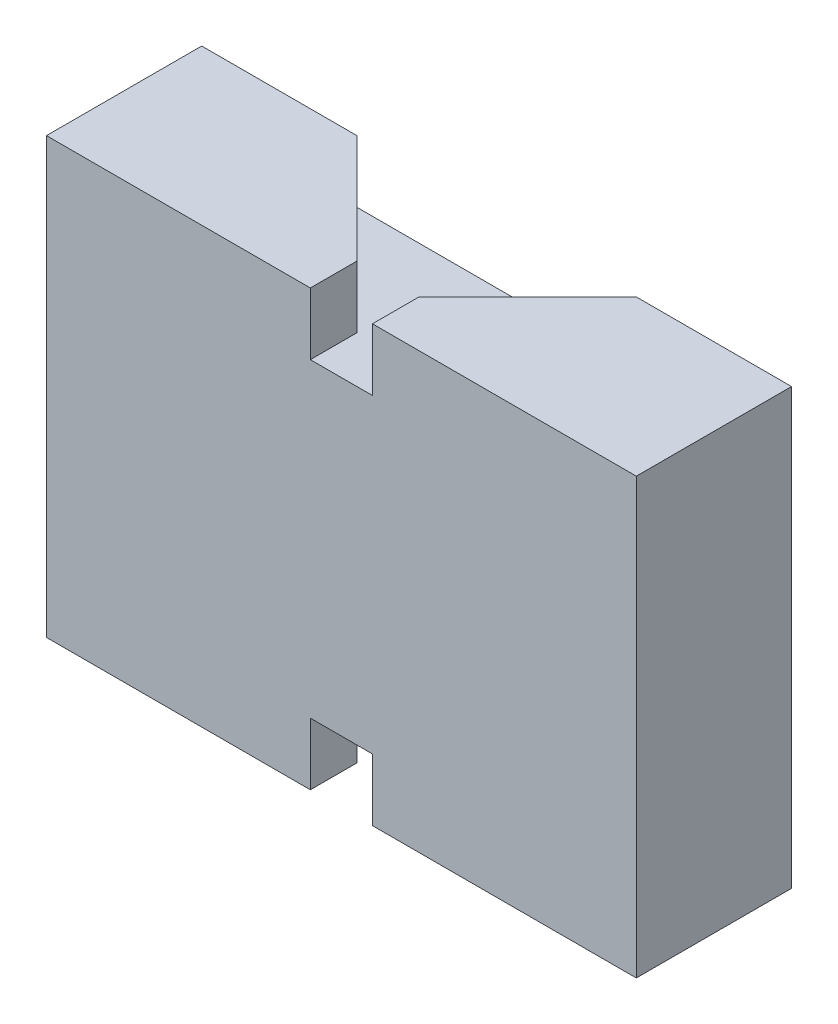
from build123d import *

# Parameters (mm, degrees)
SKETCH1_W           = 190
SKETCH1_H           = 140
BOSS_EXTRUDE1_DEPTH = 50
CUT_EXTRUDE1_DEPTH  = 20


with BuildPart() as part:
    # Sketch1 → Boss-Extrude1 (new body)
    with BuildSketch(Plane.XY):
        Rectangle(SKETCH1_W, SKETCH1_H)
    extrude(amount=BOSS_EXTRUDE1_DEPTH)

    # Sketch2 → Cut-Extrude1 (cut)
    with BuildSketch(Plane(origin=(0, -70, 0), x_dir=(-1, 0, 0), z_dir=(0, -1, 0))):
        Polygon((-10, -50), (10, -50), (10, -35), (45, 0), (-45, 0), (-10, -35), align=None)
    cut_extrude1 = extrude(amount=-CUT_EXTRUDE1_DEPTH, mode=Mode.SUBTRACT)

    # Mirror1: Cut-Extrude1 across plane
    add(cut_extrude1.mirror(Plane(origin=(0, 0, 0), x_dir=(0, 0, 1), z_dir=(0, -1, 0))), mode=Mode.SUBTRACT)


solid = part.part
